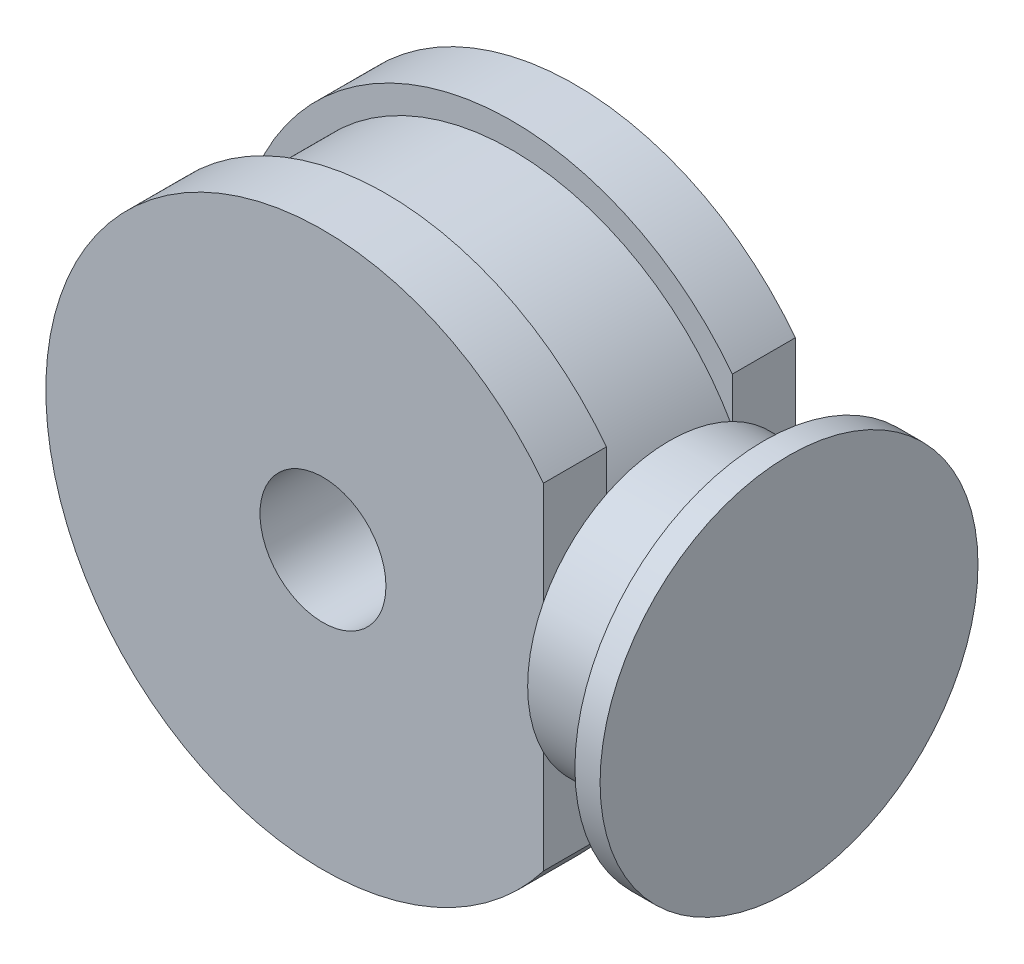
from build123d import *

# Parameters (mm, degrees)
ESQUISSE1_R             = 44
BOSS_EXTRU_1_DEPTH      = 10
ESQUISSE2_R             = 40
BOSS_EXTRU_2_DEPTH      = 20
ESQUISSE3_R             = 44
BOSS_EXTRU_3_DEPTH      = 10
ESQUISSE5_W             = 32.472445712
ESQUISSE5_H             = 94.731646138
ENL_V_MAT_EXTRU_2_DEPTH = 74.972968036
ESQUISSE4_R             = 10
ENL_V_MAT_EXTRU_1_DEPTH = 74.972968036
SKETCH1_R               = 22.5
BOSS_EXTRUDE1_DEPTH     = 15
SKETCH2_R               = 30
BOSS_EXTRUDE2_DEPTH     = 4


with BuildPart() as part:
    # Esquisse1 → Boss.-Extru.1 (new body)
    with BuildSketch(Plane.XY):
        Circle(ESQUISSE1_R)
    extrude(amount=BOSS_EXTRU_1_DEPTH)

    # Esquisse2 → Boss.-Extru.2 (add)
    with BuildSketch(Plane.XY.offset(10)):
        Circle(ESQUISSE2_R)
    extrude(amount=BOSS_EXTRU_2_DEPTH)

    # Esquisse3 → Boss.-Extru.3 (add)
    with BuildSketch(Plane.XY.offset(30)):
        Circle(ESQUISSE3_R)
    extrude(amount=BOSS_EXTRU_3_DEPTH)

    # Esquisse5 → Enlèv. mat.-Extru.2 (cut, through all)
    with BuildSketch(Plane.XY.offset(40)):
        with Locations((51.236222856, -3.296075317)):
            Rectangle(ESQUISSE5_W, ESQUISSE5_H)
    extrude(amount=-ENL_V_MAT_EXTRU_2_DEPTH, mode=Mode.SUBTRACT)

    # Esquisse4 → Enlèv. mat.-Extru.1 (cut, through all)
    with BuildSketch(Plane.XY.offset(40)):
        Circle(ESQUISSE4_R)
    extrude(amount=-ENL_V_MAT_EXTRU_1_DEPTH, mode=Mode.SUBTRACT)

    # Sketch1 → Boss-Extrude1 (add)
    with BuildSketch(Plane(origin=(35, 0, 0), x_dir=(0, 0, -1), z_dir=(1, 0, 0))):
        with Locations((-20, 0)):
            Circle(SKETCH1_R)
    extrude(amount=BOSS_EXTRUDE1_DEPTH)

    # Sketch2 → Boss-Extrude2 (add)
    with BuildSketch(Plane(origin=(50, 0, 0), x_dir=(0, 0, -1), z_dir=(1, 0, 0))):
        with Locations((-20, 0)):
            Circle(SKETCH2_R)
    extrude(amount=BOSS_EXTRUDE2_DEPTH)


solid = part.part
